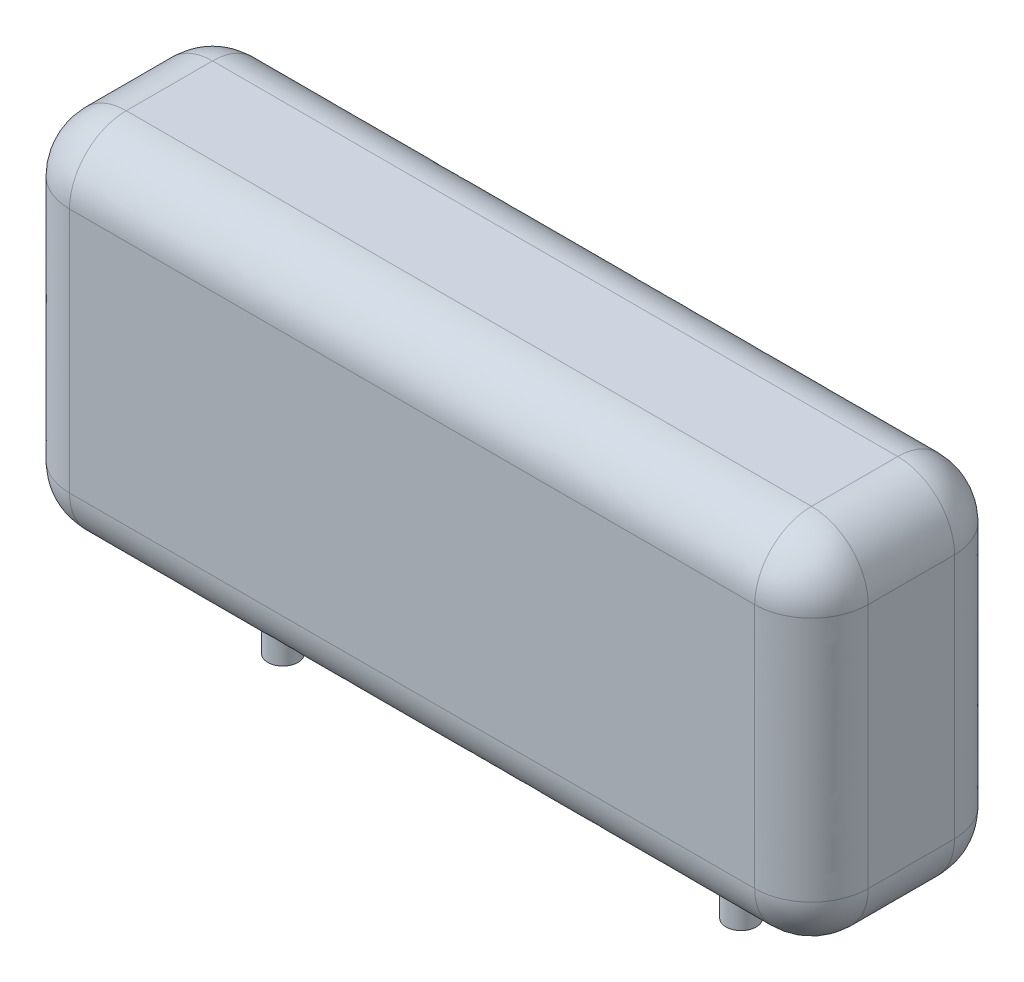
from build123d import *

# Parameters (mm, degrees)
SKETCH_1_W      = 21.11
SKETCH_1_H      = 5.28
EXTRUDE_3_DEPTH = 9.5
FILLET_2_R      = 1.5
SKETCH_2_R      = 0.4
EXTRUDE_4_DEPTH = 2


with BuildPart() as part:
    # Эскиз1 → Бобышка-Вытянуть3 (new body)
    with BuildSketch(Plane(origin=(0, 0, 0), x_dir=(1, 0, 0), z_dir=(0, 1, 0))):
        with Locations((-19.176685615, -9.547312572)):
            Rectangle(SKETCH_1_W, SKETCH_1_H)
    extrude(amount=EXTRUDE_3_DEPTH)

    # Скругление переменного радиуса2
    fillet_2_edges = [part.edges().sort_by_distance(p)[0] for p in [
        (-29.731685615, 0, 9.547312572),
        (-8.621685615, 0, 9.547312572),
        (-19.176685615, 0, 12.187312572),
        (-19.176685615, 0, 6.907312572),
        (-29.731685615, 4.75, 12.187312572),
        (-29.731685615, 4.75, 6.907312572),
        (-8.621685615, 4.75, 6.907312572),
        (-8.621685615, 4.75, 12.187312572),
        (-29.731685615, 9.5, 9.547312572),
        (-19.176685615, 9.5, 6.907312572),
        (-8.621685615, 9.5, 9.547312572),
        (-19.176685615, 9.5, 12.187312572),
    ]]
    fillet(fillet_2_edges, radius=FILLET_2_R)

    # Эскиз2 → Бобышка-Вытянуть4 (add)
    with BuildSketch(Plane(origin=(0, 0, 0), x_dir=(-1, 0, 0), z_dir=(0, -1, 0))):
        with Locations((25.231685615, -9.547312572)):
            Circle(SKETCH_2_R)
        with Locations((13.121685615, -9.547312572)):
            Circle(SKETCH_2_R)
    extrude(amount=EXTRUDE_4_DEPTH)


solid = part.part
